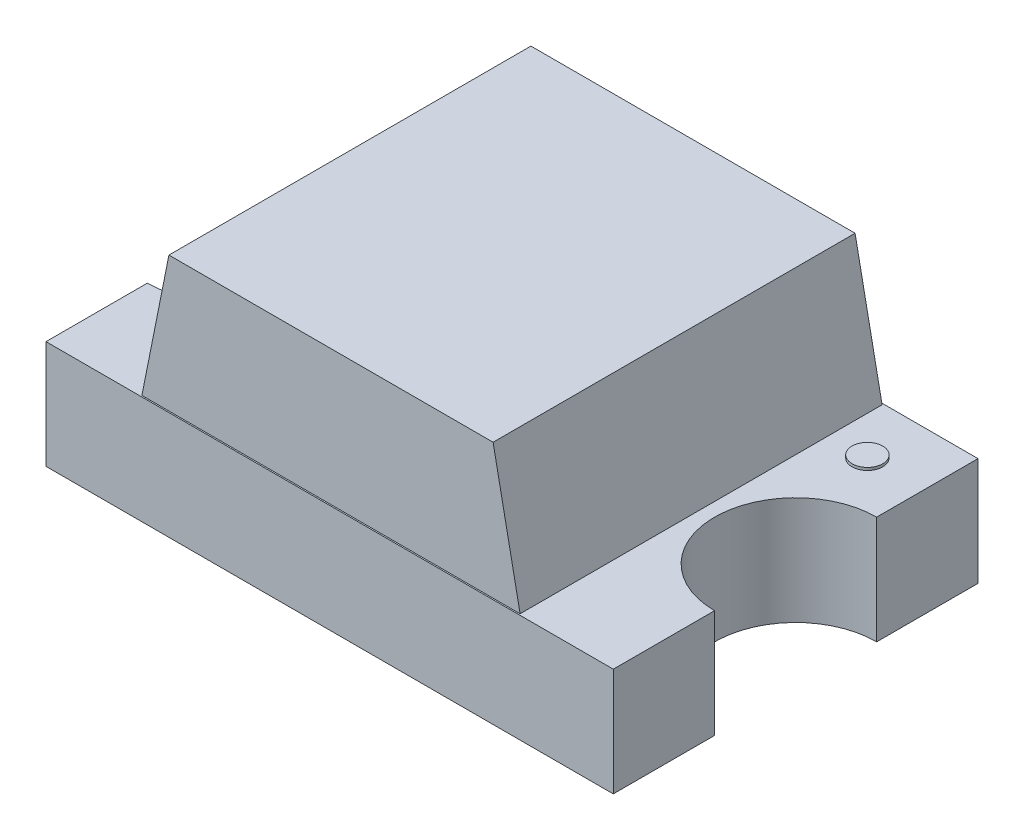
from build123d import *

# Parameters (mm, degrees)
BOSS_EXTRUDE1_DEPTH = 0.4
SKETCH2_W           = 1.4
SKETCH2_H           = 1.34
BOSS_EXTRUDE2_DEPTH = 0.5
CHAMFER1_SIZE       = 0.5
CHAMFER1_SIZE_2     = 0.1
SKETCH3_R           = 0.05678725
BOSS_EXTRUDE3_DEPTH = 0.01


with BuildPart() as part:
    # Sketch1 → Boss-Extrude1 (new body)
    with BuildSketch(Plane(origin=(0, 0, 0), x_dir=(1, 0, 0), z_dir=(0, 1, 0))):
        with BuildLine():
            Line((-1.05, -0.675), (1.05, -0.675))
            Line((1.05, -0.675), (1.05, -0.3))
            ThreePointArc((1.05, -0.3), (0.75, 0), (1.05, 0.3))
            Line((1.05, 0.3), (1.05, 0.675))
            Line((1.05, 0.675), (-1.05, 0.675))
            Line((-1.05, 0.675), (-1.05, 0.3))
            ThreePointArc((-1.05, 0.3), (-0.75, 0), (-1.05, -0.3))
            Line((-1.05, -0.3), (-1.05, -0.675))
        make_face()
    extrude(amount=BOSS_EXTRUDE1_DEPTH)

    # Sketch3 → Boss-Extrude3 (add)
    with BuildSketch(Plane(origin=(0, 0.4, 0), x_dir=(1, 0, 0), z_dir=(0, 1, 0))):
        with Locations(Location((0.843395819, 0.472175465, 0), (0, 0, 90))):
            Circle(SKETCH3_R)
    extrude(amount=BOSS_EXTRUDE3_DEPTH)


with BuildPart() as body_2:
    # Sketch2 → Boss-Extrude2 (new body)
    with BuildSketch(Plane(origin=(0, 0.4, 0), x_dir=(1, 0, 0), z_dir=(0, 1, 0))):
        Rectangle(SKETCH2_W, SKETCH2_H)
    extrude(amount=BOSS_EXTRUDE2_DEPTH)

    # Chamfer1
    # the kernel refuses this chamfer: 0.5, 0.1 mm, written as the material it takes off along each edge
    with BuildSketch(Plane(origin=(0.7, 0.9, 1.969066043), x_dir=(0.007548351224040691, -0.9999715107910818, 0), z_dir=(0, 0, -1)), Plane(origin=(-0.7, 0.9, -1.969066043), x_dir=(-0.007548351224040691, -0.9999715107910818, 0), z_dir=(0, 0, 1))) as chamfer1_piece_1:
        Polygon((CHAMFER1_SIZE * 0.999971510791, CHAMFER1_SIZE * 0.00754835122404), (-CHAMFER1_SIZE_2 * 0.00754835122404, CHAMFER1_SIZE_2 * 0.999971510791), (0, 0), align=None)
    extrude(amount=3.938132086, mode=Mode.SUBTRACT)


solid = Compound([part.part, body_2.part])
